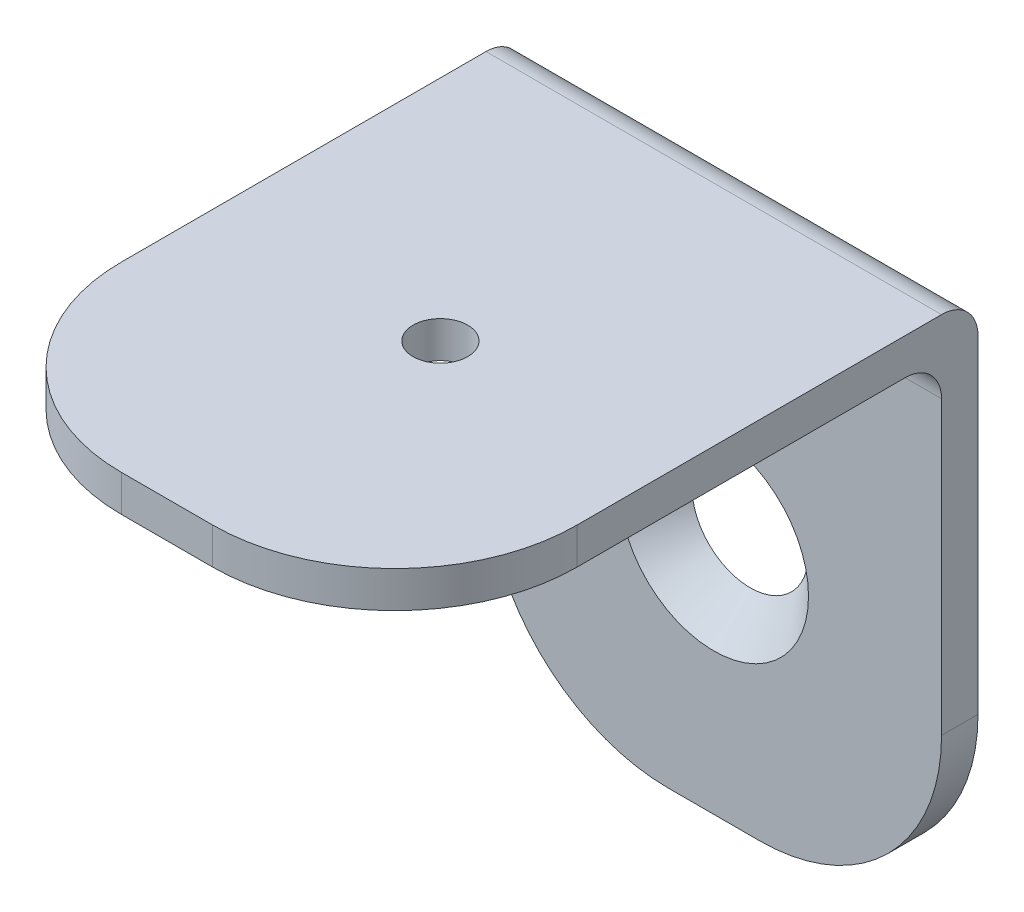
from build123d import *

# Parameters (mm, degrees)
EXTRUDE_1_DEPTH     = 2
EXTRUDE_2_DEPTH     = 2
FILLET_1_R          = 2
FILLET_2_R          = 2
SKETCH_8_R          = 1.5
CUT_EXTRUDE_1_DEPTH = 10


with BuildPart() as part:
    # Эскиз1 → Бобышка-Вытянуть1 (new body)
    with BuildSketch(Plane(origin=(0, 0, 0), x_dir=(1, 0, 0), z_dir=(0, 1, 0))):
        with BuildLine():
            Line((-2.5, -15), (2.5, -15))
            ThreePointArc((2.5, -15), (9.571067812, -12.071067812), (12.5, -5))
            Line((12.5, -5), (12.5, 15))
            Line((12.5, 15), (-12.5, 15))
            Line((-12.5, 15), (-12.5, -5))
            ThreePointArc((-12.5, -5), (-9.571067812, -12.071067812), (-2.5, -15))
        make_face()
    extrude(amount=EXTRUDE_1_DEPTH)

    # Эскиз3 → Бобышка-Вытянуть2 (add)
    with BuildSketch(Plane(origin=(0, 0, -15), x_dir=(-1, 0, 0), z_dir=(0, 0, -1))):
        with BuildLine():
            Line((-2.5, -28), (2.5, -28))
            ThreePointArc((2.5, -28), (9.571067812, -25.071067812), (12.5, -18))
            Line((12.5, -18), (12.5, 2))
            Line((12.5, 2), (-12.5, 2))
            Line((-12.5, 2), (-12.5, -18))
            ThreePointArc((-12.5, -18), (-9.571067812, -25.071067812), (-2.5, -28))
        make_face()
    extrude(amount=EXTRUDE_2_DEPTH)

    # Скругление1
    fillet_1_edges = [part.edges().sort_by_distance(p)[0] for p in [
        (0, 0, -15),
    ]]
    fillet(fillet_1_edges, radius=FILLET_1_R)

    # Скругление2
    fillet_2_edges = [part.edges().sort_by_distance(p)[0] for p in [
        (0, 2, -17),
    ]]
    fillet(fillet_2_edges, radius=FILLET_2_R)

    # Эскиз7 → Зенковка для винта с полупотайной головкой M52 (revolve, cut)
    with BuildSketch(Plane(origin=(0, -15.034247801, -15), x_dir=(0, -1, 0), z_dir=(1, 0, 0))):
        Polygon((0, 0), (0, 2), (2.75, 2), (2.75, 2.45), (5.2, 0), align=None)
    revolve(axis=Axis((0, -15.034247801, -8.65), (0, 0, -1)), mode=Mode.SUBTRACT)

    # Эскиз8 → Вырез-Вытянуть1 (cut)
    with BuildSketch(Plane.XZ):
        Circle(SKETCH_8_R)
    extrude(amount=-CUT_EXTRUDE_1_DEPTH, mode=Mode.SUBTRACT)


solid = part.part
